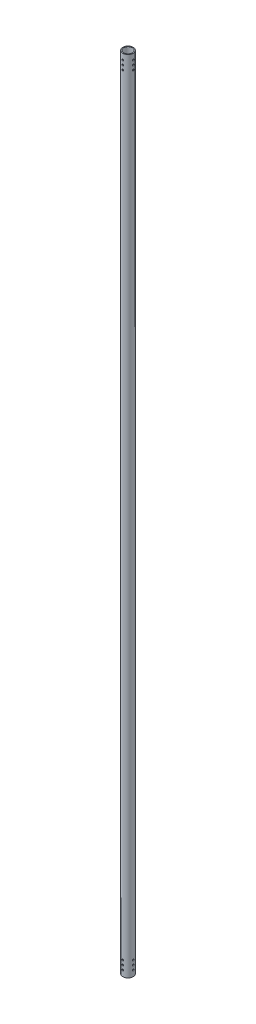
from build123d import *

# Parameters (mm, degrees)
EXTRUDE_1_OUTLINE_R                = 18
EXTRUDE_1_OUTLINE_R_2              = 15
EXTRUDE_1_DEPTH                    = 2770
SKETCH_2_R                         = 3
CUT_EXTRUDE_1_DEPTH                = 2771.11696504
PATTERN_LINEAR_1_COUNT             = 3
PATTERN_LINEAR_1_PITCH             = 15
PATTERN_CIRCULAR_1_COUNT           = 2
PATTERN_CIRCULAR_1_ANGLE           = 90
PATTERN_CIRCULAR_1_COPY_1_SKETCH_R = 3
PATTERN_CIRCULAR_1_COPY_1_DEPTH    = 2771.11696504
PATTERN_CIRCULAR_1_COPY_2_SKETCH_R = 3
PATTERN_CIRCULAR_1_COPY_2_DEPTH    = 2771.11696504


# Read off the part's stored shape, not the designer's step: Вытянуть-Тонкостенный1
with BuildPart() as part:
    # Вытянуть-Тонкостенный1 outline → Вытянуть-Тонкостенный1 (new body)
    with BuildSketch(Plane(origin=(0, 0, 0), x_dir=(1, 0, 0), z_dir=(0, 1, 0))):
        Circle(EXTRUDE_1_OUTLINE_R)
        Circle(EXTRUDE_1_OUTLINE_R_2, mode=Mode.SUBTRACT)
    extrude(amount=EXTRUDE_1_DEPTH)

    # Эскиз2 → Вырез-Вытянуть1 (cut, symmetric)
    with BuildSketch(Plane.XY):
        with Locations((0, 2720)):
            Circle(SKETCH_2_R)
        with Locations((0, 44)):
            Circle(SKETCH_2_R)
    cut_extrude_1 = extrude(amount=CUT_EXTRUDE_1_DEPTH, both=True, mode=Mode.SUBTRACT)

    # Линейный массив1: Вырез-Вытянуть1 ×3
    with Locations(*[(0, i * PATTERN_LINEAR_1_PITCH, 0) for i in range(1, PATTERN_LINEAR_1_COUNT)]):
        add(cut_extrude_1, mode=Mode.SUBTRACT)

    # Круговой массив1: Вырез-Вытянуть1 ×2 about axis
    pattern_circular_1_axis = Axis((0, 2770, 0), (0, -1, 0))
    for i in range(1, PATTERN_CIRCULAR_1_COUNT):
        add(cut_extrude_1.rotate(pattern_circular_1_axis, i * PATTERN_CIRCULAR_1_ANGLE / (PATTERN_CIRCULAR_1_COUNT - 1)), mode=Mode.SUBTRACT)

    # Круговой массив1 copy 1 sketch → Круговой массив1 copy 1 (cut, symmetric)
    with BuildSketch(Plane(origin=(0, 15, 0), x_dir=(0, 0, 1), z_dir=(-1, 0, 0))):
        with Locations((0, 2720)):
            Circle(PATTERN_CIRCULAR_1_COPY_1_SKETCH_R)
        with Locations((0, 44)):
            Circle(PATTERN_CIRCULAR_1_COPY_1_SKETCH_R)
    extrude(amount=PATTERN_CIRCULAR_1_COPY_1_DEPTH, both=True, mode=Mode.SUBTRACT)

    # Круговой массив1 copy 2 sketch → Круговой массив1 copy 2 (cut, symmetric)
    with BuildSketch(Plane(origin=(0, 30, 0), x_dir=(0, 0, 1), z_dir=(-1, 0, 0))):
        with Locations((0, 2720)):
            Circle(PATTERN_CIRCULAR_1_COPY_2_SKETCH_R)
        with Locations((0, 44)):
            Circle(PATTERN_CIRCULAR_1_COPY_2_SKETCH_R)
    extrude(amount=PATTERN_CIRCULAR_1_COPY_2_DEPTH, both=True, mode=Mode.SUBTRACT)

    # Surface Cut 1
    split(bisect_by=Plane(origin=(0, 24, 0), x_dir=(1, 0, 0), z_dir=(0, 1, 0)), keep=Keep.TOP)


solid = part.part
